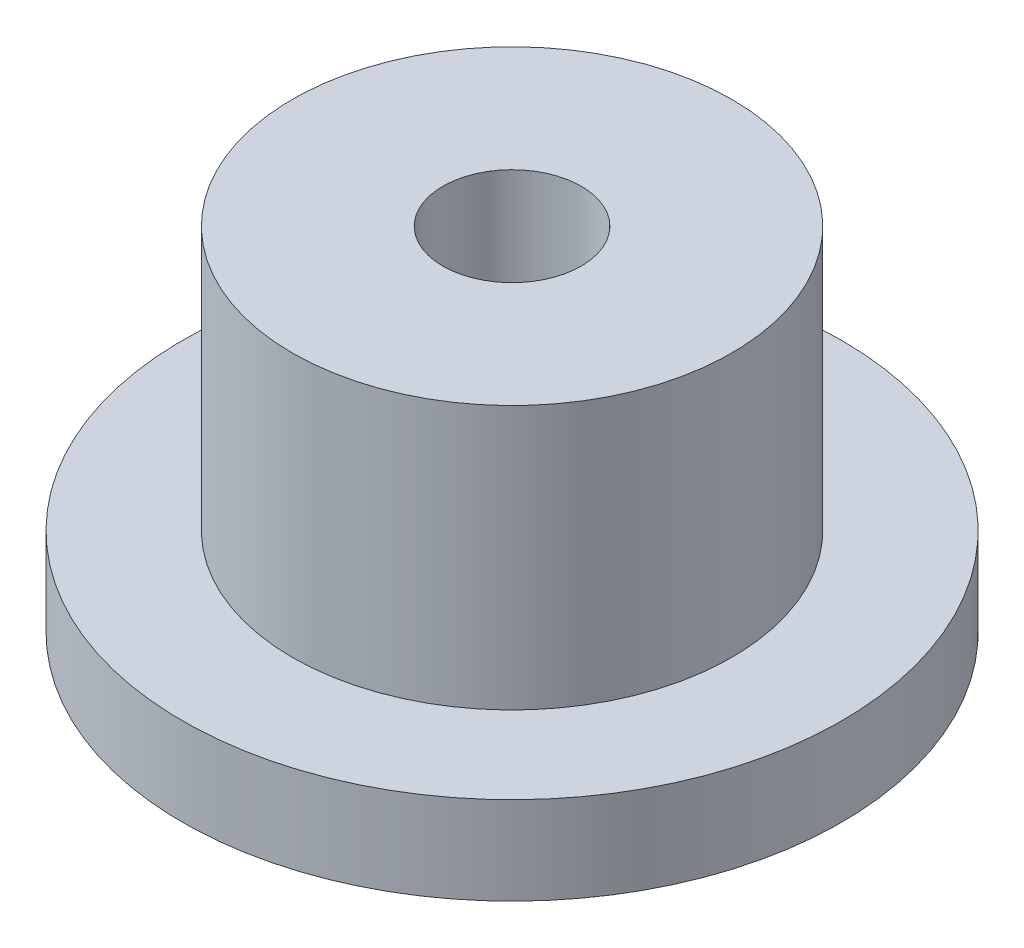
from build123d import *

# Parameters (mm, degrees)
SKETCH3_R          = 2
CUT_EXTRUDE1_DEPTH = 17.872369425


with BuildPart() as part:
    # Sketch2 → Revolve1 (revolve)
    with BuildSketch(Plane(origin=(0, 0, 0), x_dir=(0, 0, -1), z_dir=(1, 0, 0))):
        Polygon((-6.35, 2.54), (-6.35, 5.08), (0, 5.08), (0, 0), (0, -5.08), (-9.525, -5.08), (-9.525, -2.54), (-6.35, -2.54), align=None)
    revolve(axis=Axis((0, 0, 0), (0, 1, 0)))

    # Sketch3 → Cut-Extrude1 (cut, through all)
    with BuildSketch(Plane(origin=(0, 5.08, 0), x_dir=(1, 0, 0), z_dir=(0, 1, 0))):
        Circle(SKETCH3_R)
    extrude(amount=-CUT_EXTRUDE1_DEPTH, mode=Mode.SUBTRACT)


solid = part.part
